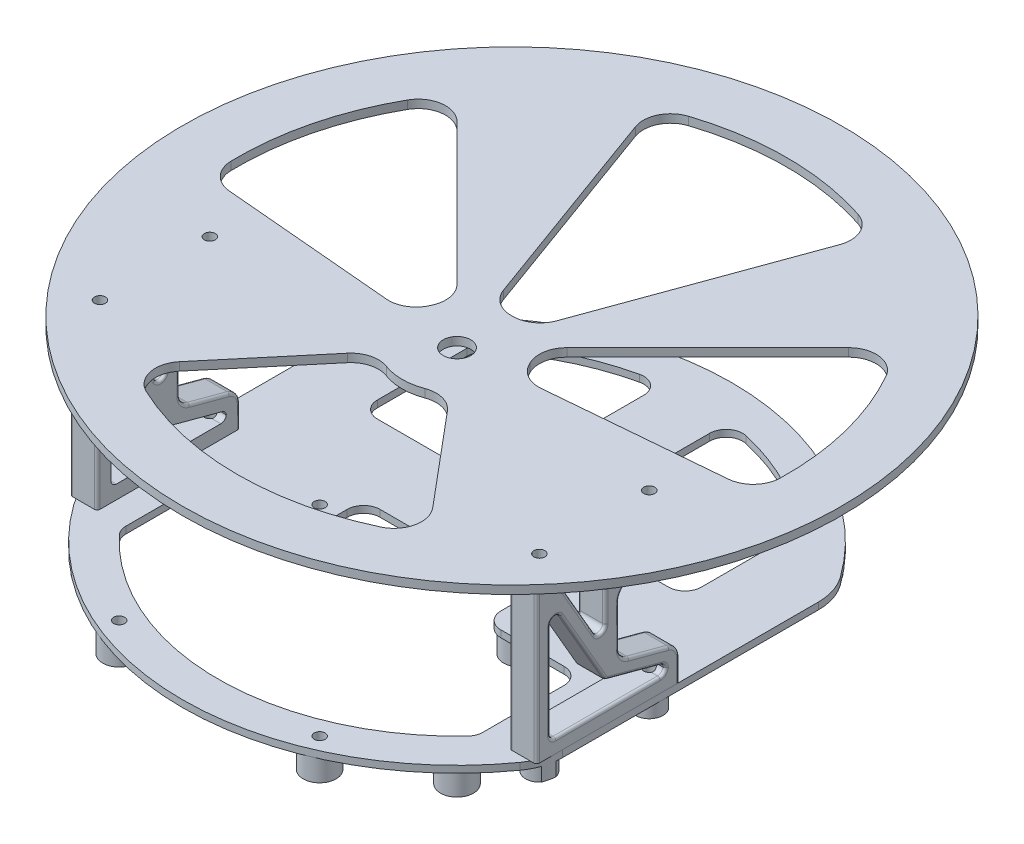
from build123d import *

# Parameters (mm, degrees)
BOSS_EXTRUDE1_DEPTH     = 1.25
SKETCH2_R               = 3
SKETCH2_R_2             = 1.125
BOSS_EXTRUDE2_DEPTH     = 4
FILLET1_R               = 10
SKETCH4_R               = 3
BOSS_EXTRUDE3_DEPTH     = 4
BOSS_EXTRUDE7_OUTLINE_R = 2.5
BOSS_EXTRUDE7_DEPTH     = 2.5
SKETCH3_R               = 1
CUT_EXTRUDE1_DEPTH      = 66.831698292
CUT_EXTRUDE2_DEPTH      = 66.743821002
FILLET2_R               = 3
BOSS_EXTRUDE4_DEPTH     = 2.5
FILLET3_R               = 2.5
FILLET4_R               = 1
FILLET5_R               = 0.5
CUT_EXTRUDE3_START      = -3.5
SKETCH8_R               = 1
CUT_EXTRUDE3_DEPTH      = 3.5
CUT_EXTRUDE4_START      = -29
SKETCH8_3_R             = 1
CUT_EXTRUDE4_DEPTH      = 3.5
SKETCH9_R               = 60
BOSS_EXTRUDE6_DEPTH     = 1.5
SKETCH12_R              = 1
SKETCH12_R_2            = 2.5
CUT_EXTRUDE7_DEPTH      = 1.5
CUT_EXTRUDE8_DEPTH      = 1.5
FILLET6_R               = 5


# Read off the part's stored shape, not the designer's step: Boss-Extrude7
with BuildPart() as part:
    # Sketch1 → Boss-Extrude1 (new body)
    with BuildSketch(Plane(origin=(0, 0, 0), x_dir=(1, 0, 0), z_dir=(0, 1, 0))):
        with BuildLine():
            Line((-42.5, 26.339134382), (-42.5, -26.339134382))
            ThreePointArc((-42.5, -26.339134382), (0, -50), (42.5, -26.339134382))
            Line((42.5, -26.339134382), (42.5, 26.339134382))
            ThreePointArc((42.5, 26.339134382), (0, 50), (-42.5, 26.339134382))
        make_face()
    extrude(amount=BOSS_EXTRUDE1_DEPTH)

    # Sketch2 → Boss-Extrude2 (add)
    # profile 1 of 4: a face of its own
    with BuildSketch(Plane.XZ):
        with Locations(Location((-33, 33, 0), (0, 0, 90))):
            Circle(SKETCH2_R)
        with Locations(Location((-33, 33, 0), (0, 0, 270))):
            Circle(SKETCH2_R_2, mode=Mode.SUBTRACT)
    # profile 2 of 4: a face of its own
    with BuildSketch(Plane.XZ):
        with Locations(Location((-33, -33, 0), (0, 0, 90))):
            Circle(SKETCH2_R)
        with Locations(Location((-33, -33, 0), (0, 0, 90))):
            Circle(SKETCH2_R_2, mode=Mode.SUBTRACT)
    # profile 3 of 4: a face of its own
    with BuildSketch(Plane.XZ):
        with Locations(Location((33, -33, 0), (0, 0, 90))):
            Circle(SKETCH2_R)
        with Locations(Location((33, -33, 0), (0, 0, 270))):
            Circle(SKETCH2_R_2, mode=Mode.SUBTRACT)
    # profile 4 of 4: a face of its own
    with BuildSketch(Plane.XZ):
        with Locations(Location((33, 33, 0), (0, 0, 90))):
            Circle(SKETCH2_R)
        with Locations(Location((33, 33, 0), (0, 0, 90))):
            Circle(SKETCH2_R_2, mode=Mode.SUBTRACT)
    extrude(amount=BOSS_EXTRUDE2_DEPTH)

    # Fillet1
    fillet1_edges = [part.edges().sort_by_distance(p)[0] for p in [
        (42.5, 0.625, -26.339134382),
        (42.5, 0.625, 26.339134382),
        (-42.5, 0.625, 26.339134382),
        (-42.5, 0.625, -26.339134382),
    ]]
    fillet(fillet1_edges, radius=FILLET1_R)

    # Sketch4 → Boss-Extrude3 (add)
    with BuildSketch(Plane.XZ):
        with Locations(Location((-18.25, 6.75, 0), (0, 0, 90))):
            Circle(SKETCH4_R)
        with Locations(Location((-18.25, 43.25, 0), (0, 0, 90))):
            Circle(SKETCH4_R)
        with Locations(Location((18.25, 43.25, 0), (0, 0, 90))):
            Circle(SKETCH4_R)
        with Locations(Location((18.25, 6.75, 0), (0, 0, 90))):
            Circle(SKETCH4_R)
    extrude(amount=BOSS_EXTRUDE3_DEPTH)

    # Boss-Extrude7 outline → Boss-Extrude7 (add)
    with BuildSketch(Plane.XZ):
        with BuildLine():
            ThreePointArc((-42.436763837, 24.441267501), (-37.560562012, 24.453060969), (-41.964951559, 26.545627824))
            ThreePointArc((-41.964951559, 26.545627824), (-42.257751952, 25.506203752), (-42.436763837, 24.441267501))
        make_face()
        with BuildLine():
            ThreePointArc((41.964951559, 26.545627824), (37.560562012, 24.453060969), (42.436763837, 24.441267501))
            ThreePointArc((42.436763837, 24.441267501), (42.257751952, 25.506203752), (41.964951559, 26.545627824))
        make_face()
        with Locations((-40, 5)):
            Circle(BOSS_EXTRUDE7_OUTLINE_R)
        with Locations((40, 5)):
            Circle(BOSS_EXTRUDE7_OUTLINE_R)
    extrude(amount=BOSS_EXTRUDE7_DEPTH)

    # Sketch3 → Cut-Extrude1 (cut, through all)
    with BuildSketch(Plane(origin=(0, 1.25, 0), x_dir=(1, 0, 0), z_dir=(0, 1, 0))):
        with Locations(Location((-18.25, -6.75, 0), (0, 0, 270))):
            Circle(SKETCH3_R)
        with Locations(Location((18.25, -6.75, 0), (0, 0, 270))):
            Circle(SKETCH3_R)
        with Locations(Location((18.25, -43.25, 0), (0, 0, 270))):
            Circle(SKETCH3_R)
        with Locations(Location((-18.25, -43.25, 0), (0, 0, 270))):
            Circle(SKETCH3_R)
        with Locations(Location((-40, -5, 0), (0, 0, 270))):
            Circle(SKETCH3_R)
        with Locations(Location((-40, -25, 0), (0, 0, 270))):
            Circle(SKETCH3_R)
        with Locations(Location((40, -25, 0), (0, 0, 270))):
            Circle(SKETCH3_R)
        with Locations(Location((40, -5, 0), (0, 0, 270))):
            Circle(SKETCH3_R)
    extrude(amount=-CUT_EXTRUDE1_DEPTH, mode=Mode.SUBTRACT)

    # Sketch6 → Cut-Extrude2 (cut, through all)
    with BuildSketch(Plane.XZ):
        with BuildLine():
            Line((-29.5, -32.645826686), (-29.5, -12))
            Line((-29.5, -12), (-6, -12))
            Line((-6, -12), (-6, -43.588989435))
            ThreePointArc((-6, -43.588989435), (-18.574194538, -39.887332541), (-29.5, -32.645826686))
        make_face()
        with BuildLine():
            Line((29.5, -12), (29.5, -32.645826686))
            ThreePointArc((29.5, -32.645826686), (18.574194538, -39.887332541), (6, -43.588989435))
            Line((6, -43.588989435), (6, -12))
            Line((6, -12), (29.5, -12))
        make_face()
        with BuildLine():
            Line((-32.5, 28.91366459), (-32.5, 10))
            Line((-32.5, 10), (-15, 10))
            Line((-15, 10), (-15, 2))
            Line((-15, 2), (15, 2))
            Line((15, 2), (15, 10))
            Line((15, 10), (32.5, 10))
            Line((32.5, 10), (32.5, 28.91366459))
            ThreePointArc((32.5, 28.91366459), (0, 43.5), (-32.5, 28.91366459))
        make_face()
    extrude(amount=-CUT_EXTRUDE2_DEPTH, mode=Mode.SUBTRACT)

    # Fillet2
    fillet2_edges = [part.edges().sort_by_distance(p)[0] for p in [
        (-32.5, 0.625, 28.91366459),
        (32.5, 0.625, 28.91366459),
        (32.5, 0.625, 10),
        (15, 0.625, 10),
        (15, 0.625, 2),
        (-15, 0.625, 2),
        (-15, 0.625, 10),
        (-32.5, 0.625, 10),
        (6, 0.625, -12),
        (29.5, 0.625, -12),
        (29.5, 0.625, -32.645826686),
        (6, 0.625, -43.588989435),
        (-6, 0.625, -43.588989435),
        (-29.5, 0.625, -32.645826686),
        (-29.5, 0.625, -12),
        (-6, 0.625, -12),
    ]]
    fillet(fillet2_edges, radius=FILLET2_R)


with BuildPart() as body_2:
    # Sketch7 → Boss-Extrude4 (new, symmetric)
    with BuildSketch(Plane.ZY.offset(40)):
        Polygon((2, 1.25), (2, 7.25), (13, 10.197441117), (13, 21.302558883), (2, 24.25), (2, 30.25), (28, 30.25), (28, 1.25), align=None)
        Polygon((4.5, 27.75), (23.854764358, 27.75), (15.5, 13.279123647), (15.5, 23.220876353), (4.5, 26.16831747), align=None, mode=Mode.SUBTRACT)
        Polygon((25.5, 3.75), (4.5, 3.75), (4.5, 5.33168253), (15.5, 8.279123647), (25.5, 25.599631722), align=None, mode=Mode.SUBTRACT)
    extrude(amount=BOSS_EXTRUDE4_DEPTH, both=True)

    # Fillet3
    fillet3_edges = [body_2.edges().sort_by_distance(p)[0] for p in [
        (-40, 7.25, 2),
        (-40, 10.197441117, 13),
        (-40, 21.302558883, 13),
        (-40, 24.25, 2),
    ]]
    fillet(fillet3_edges, radius=FILLET3_R)

    # Fillet4
    # the kernel refuses this fillet: 1 mm, written as the material it adds along each edge
    with BuildSketch(Plane(origin=(-42.5, 25.599631722, 25.5), x_dir=(0, -1, 0), z_dir=(1, 0, 0)), Plane(origin=(-42.5, 13.279123647, 15.5), x_dir=(0, 1, 0), z_dir=(1, 0, 0))) as fillet4_piece_1:
        with BuildLine():
            CenterArc((FILLET4_R * 3.73205080757, FILLET4_R), FILLET4_R, 120, 150)
            Line((FILLET4_R * 3.23205080757, FILLET4_R * 1.86602540378), (0, 0))
            Line((0, 0), (FILLET4_R * 3.73205080757, 0))
        make_face()
    extrude(amount=5)
    with BuildSketch(Plane(origin=(-42.5, 5.33168253, 4.5), x_dir=(0, 0.25881904510251347, 0.9659258262890702), z_dir=(1, 0, 0)), Plane(origin=(-42.5, 26.16831747, 4.5), x_dir=(0, 1, 0), z_dir=(1, 0, 0))) as fillet4_piece_2:
        with BuildLine():
            CenterArc((FILLET4_R * 0.767326987979, FILLET4_R), FILLET4_R, 195, 75)
            Line((-FILLET4_R * 0.19859883831, FILLET4_R * 0.741180954897), (0, 0))
            Line((0, 0), (FILLET4_R * 0.767326987979, 0))
        make_face()
    extrude(amount=5)
    with BuildSketch(Plane(origin=(-37.5, 3.75, 25.5), x_dir=(0, 1, 0), z_dir=(-1, 0, 0)), Plane(origin=(-42.5, 3.75, 4.5), x_dir=(0, 1, 0), z_dir=(1, 0, 0)), Plane(origin=(-37.5, 27.75, 4.5), x_dir=(0, -1, 0), z_dir=(-1, 0, 0))) as fillet4_piece_3:
        with BuildLine():
            CenterArc((FILLET4_R, FILLET4_R), FILLET4_R, 180, 90)
            Line((0, FILLET4_R), (0, 0))
            Line((0, 0), (FILLET4_R, 0))
        make_face()
    extrude(amount=5)
    with BuildSketch(Plane(origin=(-42.5, 27.75, 23.854764358), x_dir=(0, -0.8660254037844419, -0.4999999999999942), z_dir=(1, 0, 0))) as fillet4_piece_4:
        with BuildLine():
            CenterArc((FILLET4_R * 1.73205080757, FILLET4_R), FILLET4_R, 150, 120)
            Line((FILLET4_R * 0.866025403784, FILLET4_R * 1.5), (0, 0))
            Line((0, 0), (FILLET4_R * 1.73205080757, 0))
        make_face()
    extrude(amount=5)
    # the kernel refuses this fillet: 1 mm, written as the material it takes off along each edge
    with BuildSketch(Plane(origin=(-43.535533906, 8.279123647, 15.5), x_dir=(0, 0.8660254037844416, 0.4999999999999949), z_dir=(1, 0, 0))) as fillet4_2_piece_1:
        with BuildLine():
            CenterArc((FILLET4_R * 0.414213562373, -FILLET4_R), FILLET4_R, 90, 45)
            Line((-FILLET4_R * 0.292893218813, -FILLET4_R * 0.292893218813), (0, 0))
            Line((0, 0), (FILLET4_R * 0.414213562373, 0))
        make_face()
    extrude(amount=7.071067812, mode=Mode.SUBTRACT)
    with BuildSketch(Plane(origin=(-44.41831747, 23.220876353, 15.5), x_dir=(0, 0.25881904510251397, -0.9659258262890702), z_dir=(1, 0, 0))) as fillet4_2_piece_2:
        with BuildLine():
            CenterArc((FILLET4_R * 0.767326987979, -FILLET4_R), FILLET4_R, 90, 75)
            Line((-FILLET4_R * 0.19859883831, -FILLET4_R * 0.741180954897), (0, 0))
            Line((0, 0), (FILLET4_R * 0.767326987979, 0))
        make_face()
    extrude(amount=8.83663494, mode=Mode.SUBTRACT)

    # Fillet5
    fillet5_edges = [body_2.edges().sort_by_distance(p)[0] for p in [
        (-42.5, 27.25, 22.988738954),
        (-42.5, 27.75, 13.811356775),
        (-42.5, 21.380587227, 20.177382179),
        (-42.5, 27.489196262, 4.826509922),
        (-42.5, 26.290680217, 4.735787249),
        (-42.5, 24.694596912, 10),
        (-42.5, 23.062310794, 15.29335334),
        (-42.5, 19.73236191, 15.5),
        (-42.5, 16.045248628, 16.241180955),
    ]]
    fillet(fillet5_edges, radius=FILLET5_R)
    fillet5_2_edges = [body_2.edges().sort_by_distance(p)[0] for p in [
        (-37.5, 27.25, 22.988738954),
        (-37.5, 27.75, 13.811356775),
        (-37.5, 21.380587227, 20.177382179),
        (-37.5, 27.489196262, 4.826509922),
        (-37.5, 26.290680217, 4.735787249),
        (-37.5, 24.694596912, 10),
        (-37.5, 23.062310794, 15.29335334),
        (-37.5, 19.73236191, 15.5),
        (-37.5, 16.045248628, 16.241180955),
    ]]
    fillet(fillet5_2_edges, radius=FILLET5_R)
    fillet5_3_edges = [body_2.edges().sort_by_distance(p)[0] for p in [
        (-42.5, 3.290841265, 2),
        (-42.5, 6.853586103, 2.516616649),
        (-42.5, 8.723720558, 7.5),
        (-42.5, 10.593855014, 12.483383351),
        (-42.5, 15.75, 13),
        (-42.5, 28.209158735, 2),
        (-42.5, 20.906144986, 12.483383351),
        (-42.5, 24.646413897, 2.516616649),
        (-42.5, 22.776279442, 7.5),
    ]]
    fillet(fillet5_3_edges, radius=FILLET5_R)
    fillet5_4_edges = [body_2.edges().sort_by_distance(p)[0] for p in [
        (-42.5, 15.75, 28),
    ]]
    fillet(fillet5_4_edges, radius=FILLET5_R)
    fillet5_5_edges = [body_2.edges().sort_by_distance(p)[0] for p in [
        (-42.5, 4.042893219, 25.207106781),
        (-42.5, 3.75, 15),
        (-42.5, 13.308790457, 25.5),
        (-42.5, 4.010803738, 4.826509922),
        (-42.5, 22.833506741, 24.758819045),
        (-42.5, 5.209319783, 4.735787249),
        (-42.5, 15.502712015, 19.670540689),
        (-42.5, 6.851099328, 10.170540689),
        (-42.5, 8.344489774, 15.449842806),
    ]]
    fillet(fillet5_5_edges, radius=FILLET5_R)
    fillet5_6_edges = [body_2.edges().sort_by_distance(p)[0] for p in [
        (-37.5, 3.290841265, 2),
        (-37.5, 6.853586103, 2.516616649),
        (-37.5, 8.723720558, 7.5),
        (-37.5, 10.593855014, 12.483383351),
        (-37.5, 15.75, 13),
        (-37.5, 28.209158735, 2),
        (-37.5, 20.906144986, 12.483383351),
        (-37.5, 24.646413897, 2.516616649),
        (-37.5, 22.776279442, 7.5),
    ]]
    fillet(fillet5_6_edges, radius=FILLET5_R)
    fillet5_7_edges = [body_2.edges().sort_by_distance(p)[0] for p in [
        (-37.5, 15.75, 28),
    ]]
    fillet(fillet5_7_edges, radius=FILLET5_R)

    # Sketch8 → Cut-Extrude3 (cut)
    with BuildSketch(Plane.XZ.offset(-1.25).offset(CUT_EXTRUDE3_START)):
        with Locations(Location((-40, 5, 0), (0, 0, 270))):
            Circle(SKETCH8_R)
        with Locations(Location((-40, 25, 0), (0, 0, 270))):
            Circle(SKETCH8_R)
    extrude(amount=CUT_EXTRUDE3_DEPTH, mode=Mode.SUBTRACT)

    # Sketch8<3> → Cut-Extrude4 (cut)
    with BuildSketch(Plane.XZ.offset(-1.25).offset(CUT_EXTRUDE4_START)):
        with Locations(Location((-40, 5, 0), (0, 0, 270))):
            Circle(SKETCH8_3_R)
        with Locations(Location((-40, 25, 0), (0, 0, 270))):
            Circle(SKETCH8_3_R)
    extrude(amount=CUT_EXTRUDE4_DEPTH, mode=Mode.SUBTRACT)


with BuildPart() as body_3:
    # Mirror1: mirrored copy
    add(body_2.part.mirror(Plane(origin=(0, 0, 0), x_dir=(0, 0, 1), z_dir=(1, 0, 0))))


with BuildPart() as body_4:
    # Sketch9 → Boss-Extrude6 (new body)
    with BuildSketch(Plane(origin=(0, 30.25, 0), x_dir=(1, 0, 0), z_dir=(0, 1, 0))):
        with Locations(Location((0, 10, 0), (0, 0, 270))):
            Circle(SKETCH9_R)
    extrude(amount=BOSS_EXTRUDE6_DEPTH)

    # Sketch12 → Cut-Extrude7 (cut)
    with BuildSketch(Plane(origin=(0, 31.75, 0), x_dir=(1, 0, 0), z_dir=(0, 1, 0))):
        with Locations(Location((40, -5, 0), (0, 0, 270))):
            Circle(SKETCH12_R)
        with Locations(Location((40, -25, 0), (0, 0, 270))):
            Circle(SKETCH12_R)
        with Locations(Location((-40, -5, 0), (0, 0, 270))):
            Circle(SKETCH12_R)
        with Locations(Location((-40, -25, 0), (0, 0, 270))):
            Circle(SKETCH12_R)
        with Locations(Location((0, 0, 0), (0, 0, 270))):
            Circle(SKETCH12_R_2)
    extrude(amount=-CUT_EXTRUDE7_DEPTH, mode=Mode.SUBTRACT)

    # Sketch13 → Cut-Extrude8 (cut)
    with BuildSketch(Plane(origin=(0, 31.75, 0), x_dir=(1, 0, 0), z_dir=(0, 1, 0))):
        with BuildLine():
            Line((-3.420201433, 9.396926208), (-20.274889547, 55.704801212))
            ThreePointArc((-20.274889547, 55.704801212), (0, 60), (20.274889547, 55.704801212))
            Line((20.274889547, 55.704801212), (3.420201433, 9.396926208))
            ThreePointArc((3.420201433, 9.396926208), (0, 10), (-3.420201433, 9.396926208))
        make_face()
        with BuildLine():
            Line((-9.961946981, 0.871557427), (-49.679337433, 4.346378837))
            ThreePointArc((-49.679337433, 4.346378837), (-48.25340471, 23.099959309), (-40, 40))
            Line((-40, 40), (-7.071067812, 7.071067812))
            ThreePointArc((-7.071067812, 7.071067812), (-9.06307787, 4.226182617), (-9.961946981, 0.871557427))
        make_face()
        with BuildLine():
            Line((7.071067812, 7.071067812), (40, 40))
            ThreePointArc((40, 40), (48.25340471, 23.099959309), (49.679337433, 4.346378837))
            Line((49.679337433, 4.346378837), (9.961946981, 0.871557427))
            ThreePointArc((9.961946981, 0.871557427), (9.06307787, 4.226182617), (7.071067812, 7.071067812))
        make_face()
        with BuildLine():
            Line((-6.427876097, -7.660444431), (-26.94865087, -32.11615149))
            ThreePointArc((-26.94865087, -32.11615149), (0, -40), (26.94865087, -32.11615149))
            Line((26.94865087, -32.11615149), (6.427876097, -7.660444431))
            ThreePointArc((6.427876097, -7.660444431), (0, -10), (-6.427876097, -7.660444431))
        make_face()
    extrude(amount=-CUT_EXTRUDE8_DEPTH, mode=Mode.SUBTRACT)

    # Fillet6
    fillet6_edges = [body_4.edges().sort_by_distance(p)[0] for p in [
        (-6.427876097, 31, 7.660444431),
        (6.427876097, 31, 7.660444431),
        (26.94865087, 31, 32.11615149),
        (-26.94865087, 31, 32.11615149),
        (9.961946981, 31, -0.871557427),
        (7.071067812, 31, -7.071067812),
        (40, 31, -40),
        (49.679337433, 31, -4.346378837),
        (-7.071067812, 31, -7.071067812),
        (-9.961946981, 31, -0.871557427),
        (-49.679337433, 31, -4.346378837),
        (-40, 31, -40),
        (3.420201433, 31, -9.396926208),
        (-3.420201433, 31, -9.396926208),
        (-20.274889547, 31, -55.704801212),
        (20.274889547, 31, -55.704801212),
    ]]
    fillet(fillet6_edges, radius=FILLET6_R)


solid = Compound([part.part, body_2.part, body_3.part, body_4.part])
